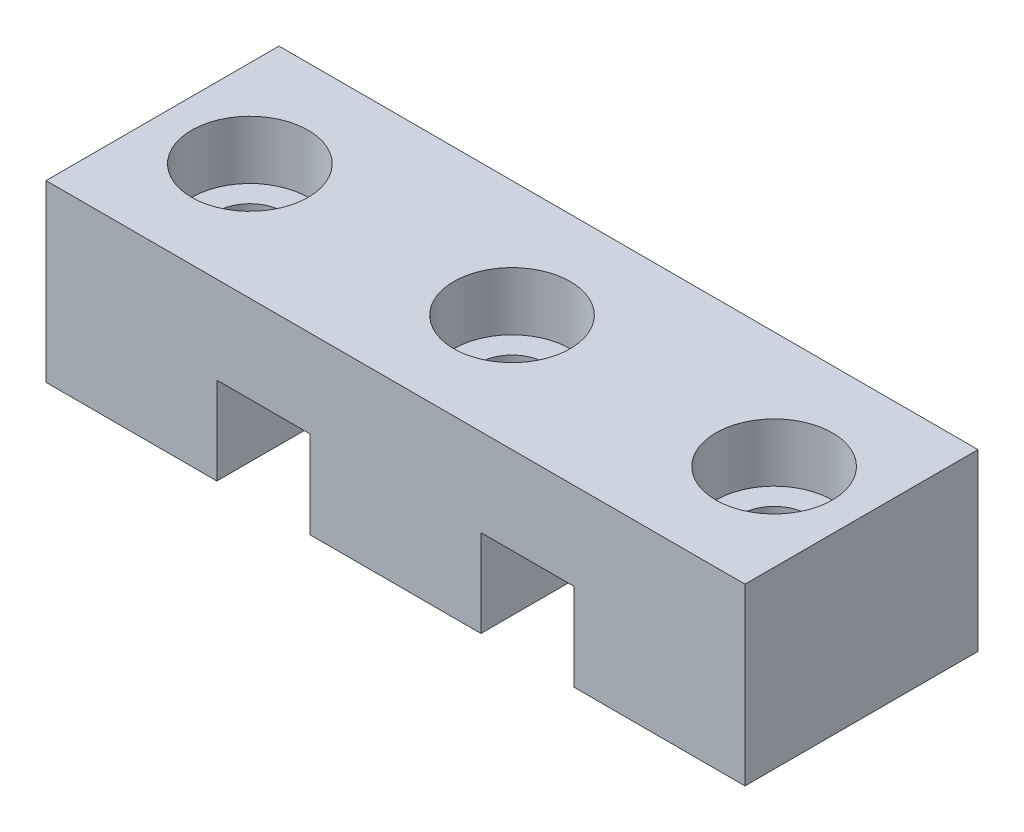
from build123d import *

# Parameters (mm, degrees)
BOSS_EXTRUDE1_DEPTH = 8
SKETCH2_R           = 1.15
CUT_EXTRUDE1_DEPTH  = 27
SKETCH3_R           = 2
CUT_EXTRUDE2_DEPTH  = 2


with BuildPart() as part:
    # Sketch1 → Boss-Extrude1 (new body)
    with BuildSketch(Plane.XY):
        Polygon((0, 0), (5.866666667, 0), (5.866666667, 3), (9.066666667, 3), (9.066666667, 0), (14.933333333, 0), (14.933333333, 3), (18.133333333, 3), (18.133333333, 0), (24, 0), (24, 6), (0, 6), align=None)
    extrude(amount=-BOSS_EXTRUDE1_DEPTH)

    # Sketch2 → Cut-Extrude1 (cut, through all)
    with BuildSketch(Plane(origin=(0, 6, 0), x_dir=(1, 0, 0), z_dir=(0, 1, 0))):
        with Locations((3, 4)):
            Circle(SKETCH2_R)
        with Locations((12, 4)):
            Circle(SKETCH2_R)
        with Locations((21, 4)):
            Circle(SKETCH2_R)
    extrude(amount=-CUT_EXTRUDE1_DEPTH, mode=Mode.SUBTRACT)

    # Sketch3 → Cut-Extrude2 (cut)
    with BuildSketch(Plane(origin=(0, 6, 0), x_dir=(1, 0, 0), z_dir=(0, 1, 0))):
        with Locations((3, 4)):
            Circle(SKETCH3_R)
        with Locations((12, 4)):
            Circle(SKETCH3_R)
        with Locations((21, 4)):
            Circle(SKETCH3_R)
    extrude(amount=-CUT_EXTRUDE2_DEPTH, mode=Mode.SUBTRACT)


solid = part.part
